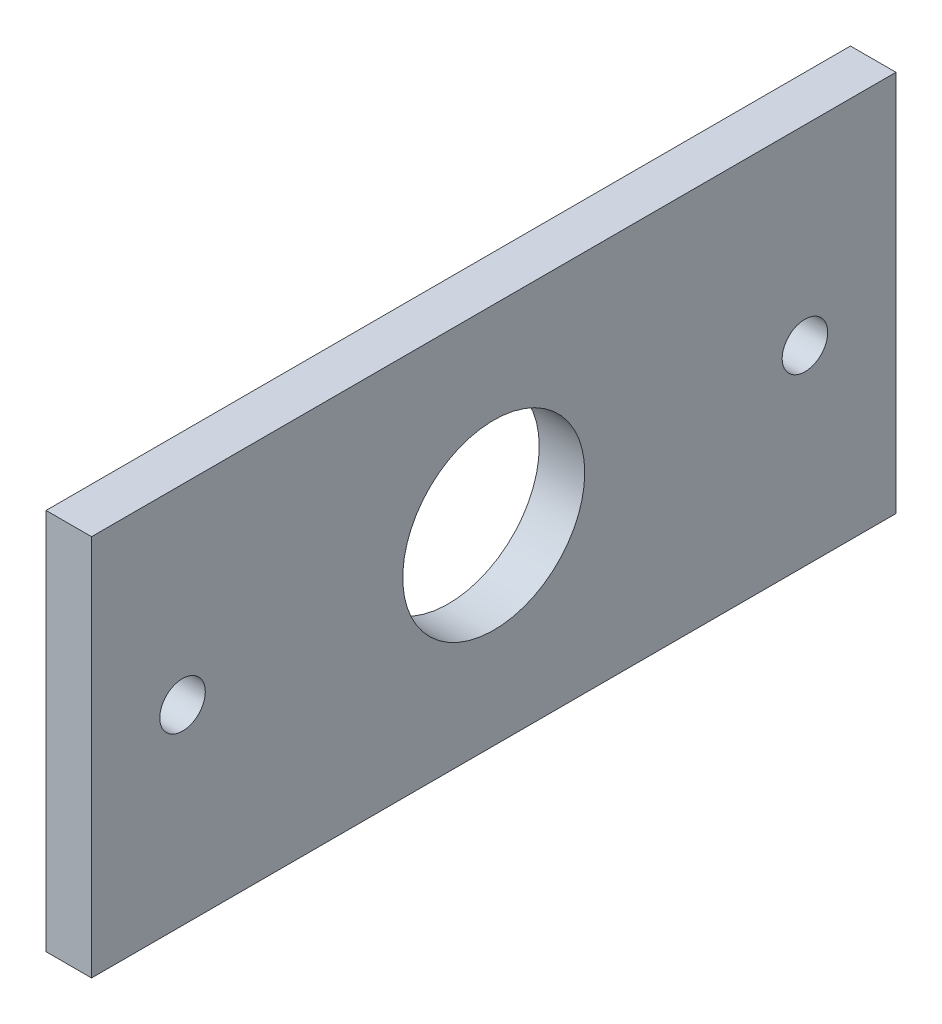
from build123d import *

# Parameters (mm, degrees)
SKETCH1_W           = 112.268
SKETCH1_H           = 53.34
SKETCH1_R           = 12.7
SKETCH1_R_2         = 3.175
BOSS_EXTRUDE1_DEPTH = 6.35


with BuildPart() as part:
    # Sketch1 → Boss-Extrude1 (new body)
    with BuildSketch(Plane(origin=(0, 0, 0), x_dir=(0, 0, -1), z_dir=(1, 0, 0))):
        Rectangle(SKETCH1_W, SKETCH1_H)
        Circle(SKETCH1_R, mode=Mode.SUBTRACT)
        with Locations((-43.434, 0)):
            Circle(SKETCH1_R_2, mode=Mode.SUBTRACT)
        with Locations((43.434, 0)):
            Circle(SKETCH1_R_2, mode=Mode.SUBTRACT)
    extrude(amount=BOSS_EXTRUDE1_DEPTH)


solid = part.part
